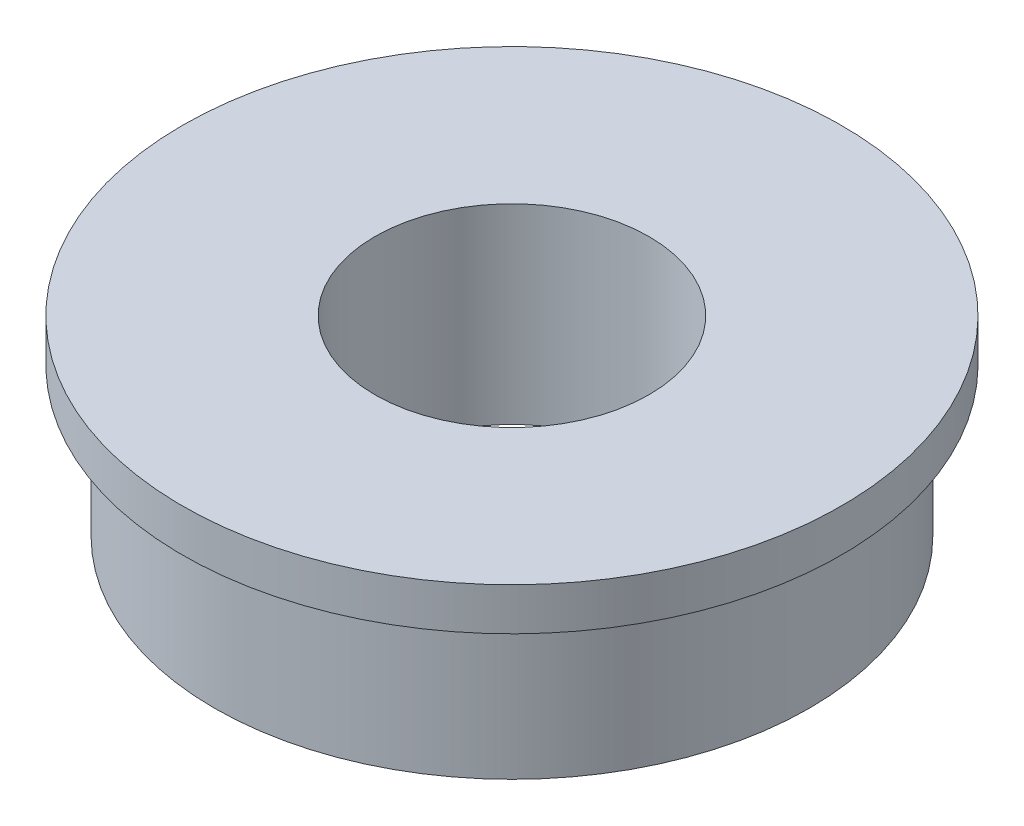
from build123d import *

# Parameters (mm, degrees)
ROUND_CORTE_DEPTH      = 18.765856553
ROUND_CORTE_DEPTH_BACK = 18.765856553
CROQUIS3_R             = 5.1181


with BuildPart() as part:
    # Croquis2 → Revolución1 (revolve)
    with BuildSketch(Plane.XY):
        Polygon((0, 3.5687), (0, -3.5687), (-11.1125, -3.5687), (-11.1125, 1.9812), (-12.3063, 1.9812), (-12.3063, 3.5687), align=None)
    revolve(axis=Axis((0, 3.5687, 0), (0, -1, 0)))

    # Croquis3 → Round Corte (cut, two sides: drawn at the far end of the back side and taken through both)
    with BuildSketch(Plane(origin=(0, 0, 0), x_dir=(1, 0, 0), z_dir=(0, 1, 0)).offset(-ROUND_CORTE_DEPTH_BACK)):
        Circle(CROQUIS3_R)
    extrude(amount=ROUND_CORTE_DEPTH + ROUND_CORTE_DEPTH_BACK, mode=Mode.SUBTRACT)


solid = part.part
